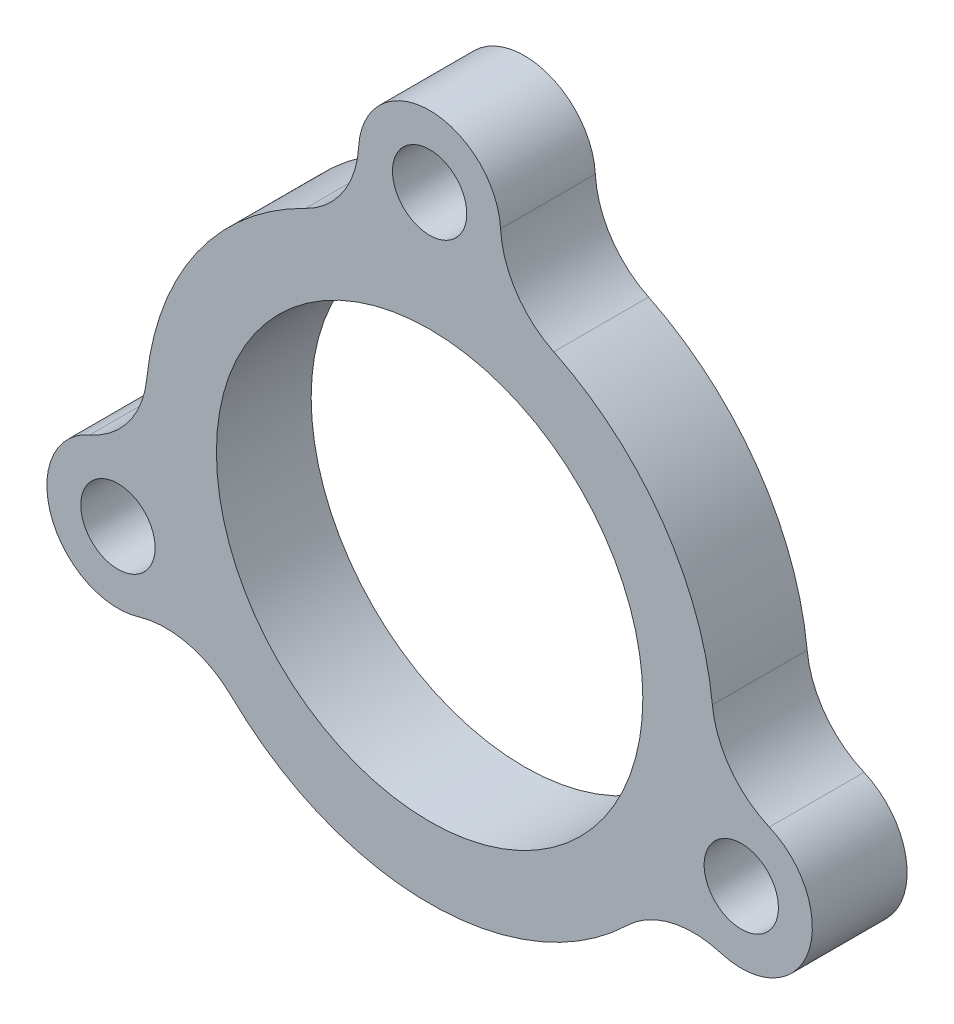
from build123d import *

# Parameters (mm, degrees)
SKETCH2_R           = 2.4892
SKETCH2_R_2         = 14.2875
BOSS_EXTRUDE1_DEPTH = 6.35
FILLET2_R           = 6.35


with BuildPart() as part:
    # Sketch2 → Boss-Extrude1 (new body)
    with BuildSketch(Plane.XY):
        with BuildLine():
            ThreePointArc((16.514920075, -9.495257496), (25.359954603, -9.230268618), (18.754596621, -3.341796759))
            ThreePointArc((18.754596621, -3.341796759), (15.604846444, 10.926631112), (3.27418807, 18.766517857))
            ThreePointArc((3.27418807, 18.766517857), (0, 26.9875), (-3.27418807, 18.766517857))
            ThreePointArc((-3.27418807, 18.766517857), (-15.604846444, 10.926631112), (-18.754596621, -3.341796759))
            ThreePointArc((-18.754596621, -3.341796759), (-25.359954603, -9.230268618), (-16.514920075, -9.495257496))
            ThreePointArc((-16.514920075, -9.495257496), (0, -19.05), (16.514920075, -9.495257496))
        make_face()
        with Locations((20.884668497, -7.601397685)):
            Circle(SKETCH2_R, mode=Mode.SUBTRACT)
        Circle(SKETCH2_R_2, mode=Mode.SUBTRACT)
        with Locations((-20.884668497, -7.601397685)):
            Circle(SKETCH2_R, mode=Mode.SUBTRACT)
        with Locations((0, 22.225)):
            Circle(SKETCH2_R, mode=Mode.SUBTRACT)
    extrude(amount=BOSS_EXTRUDE1_DEPTH)

    # Fillet2
    fillet2_edges = [part.edges().sort_by_distance(p)[0] for p in [
        (-18.754596621, -3.341796759, 3.175),
        (-3.27418807, 18.766517857, 3.175),
        (18.754596621, -3.341796759, 3.175),
        (16.514920075, -9.495257496, 3.175),
        (-16.514920075, -9.495257496, 3.175),
        (3.27418807, 18.766517857, 3.175),
    ]]
    fillet(fillet2_edges, radius=FILLET2_R)


solid = part.part
